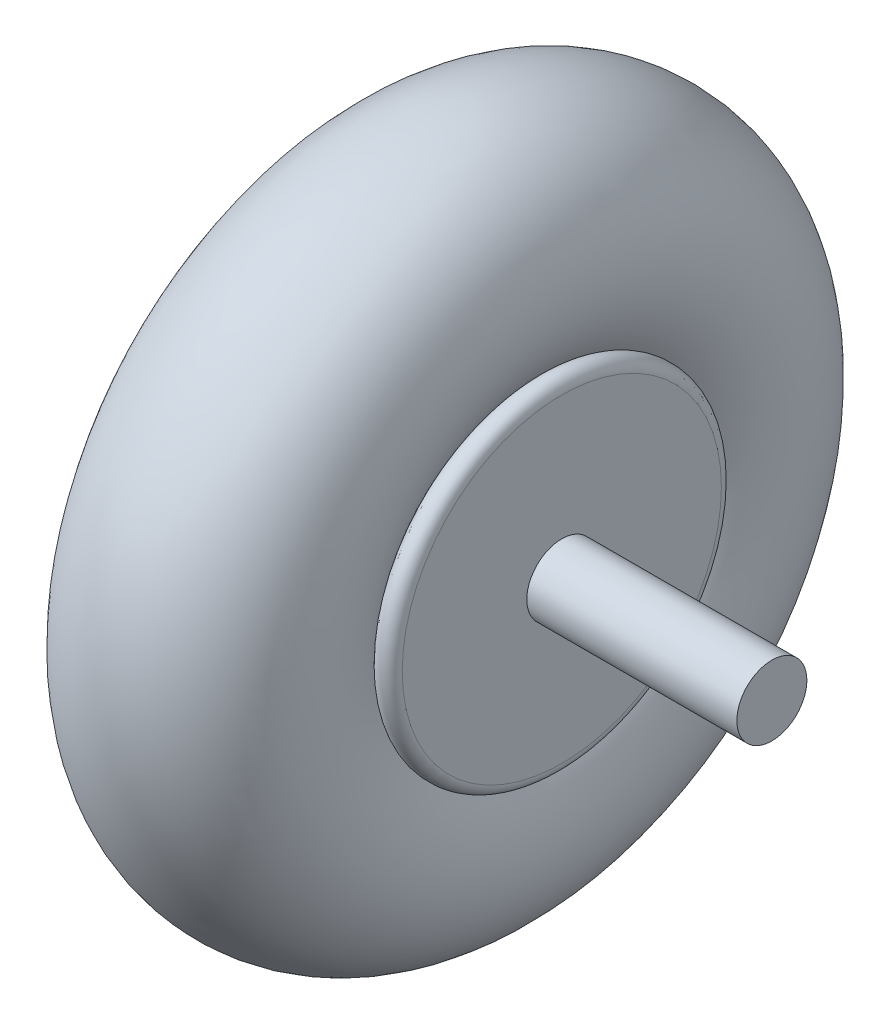
from build123d import *

# Parameters (mm, degrees)
SKETCH_5_W      = 12
SKETCH_5_H      = 10
EXTRUDE_3_DEPTH = 1
FILLET_2_R      = 1
SKETCH_6_R      = 10
SKETCH_10_R     = 3
EXTRUDE_6_DEPTH = 18
SKETCH_11_R     = 3
EXTRUDE_7_DEPTH = 8


with BuildPart() as part:
    # 草图5 → 凸台-拉伸3 (new body)
    with BuildSketch(Plane.XY):
        Rectangle(SKETCH_5_W, SKETCH_5_H)
    extrude(amount=EXTRUDE_3_DEPTH)

    # 草图9 → 旋转1 (revolve)
    with BuildSketch(Plane(origin=(0, 0, 0), x_dir=(-1, 0, 0), z_dir=(0, 0, -1))):
        with BuildLine():
            Line((10, 20), (10, 0))
            Line((10, 0), (-10, 0))
            Line((-10, 0), (-10, 20))
            ThreePointArc((-10, 20), (0, 10), (10, 20))
        make_face()
    revolve(axis=Axis((10, 0, 0), (-1, 0, 0)))

    # 圆角2
    fillet_2_edges = [part.edges().sort_by_distance(p)[0] for p in [
        (10, -20, 0),
    ]]
    fillet(fillet_2_edges, radius=FILLET_2_R)
    fillet_2_2_edges = [part.edges().sort_by_distance(p)[0] for p in [
        (-10, -20, 0),
    ]]
    fillet(fillet_2_2_edges, radius=FILLET_2_R)


with BuildPart() as body_2:
    # 扫描3: sweep along a path in 草图7
    with BuildLine(Plane(origin=(0, 0, 0), x_dir=(0, 0, -1), z_dir=(1, 0, 0))) as sweep_3_path:
        CenterArc((0, 0), 20, 0, 360)
    # 草图6 → 扫描3 (sweep)
    with BuildSketch(Plane.XY):
        with Locations((0, 20)):
            Circle(SKETCH_6_R)
    sweep(path=sweep_3_path.line)


with BuildPart() as body_3:
    # 草图10 → 凸台-拉伸6 (new body)
    with BuildSketch(Plane(origin=(10, 0, 0), x_dir=(0, 0, -1), z_dir=(1, 0, 0))):
        Circle(SKETCH_10_R)
    extrude(amount=EXTRUDE_6_DEPTH)

    # Combine 1: union part
    add(part.part)


with BuildPart() as body_3_2:
    # 草图11 → 凸台-拉伸7 (new body)
    with BuildSketch(Plane.ZY.offset(10)):
        Circle(SKETCH_11_R)
    extrude(amount=EXTRUDE_7_DEPTH)

    # Combine 2: union body 3
    add(body_3.part)


solid = Compound([body_2.part, body_3_2.part])
